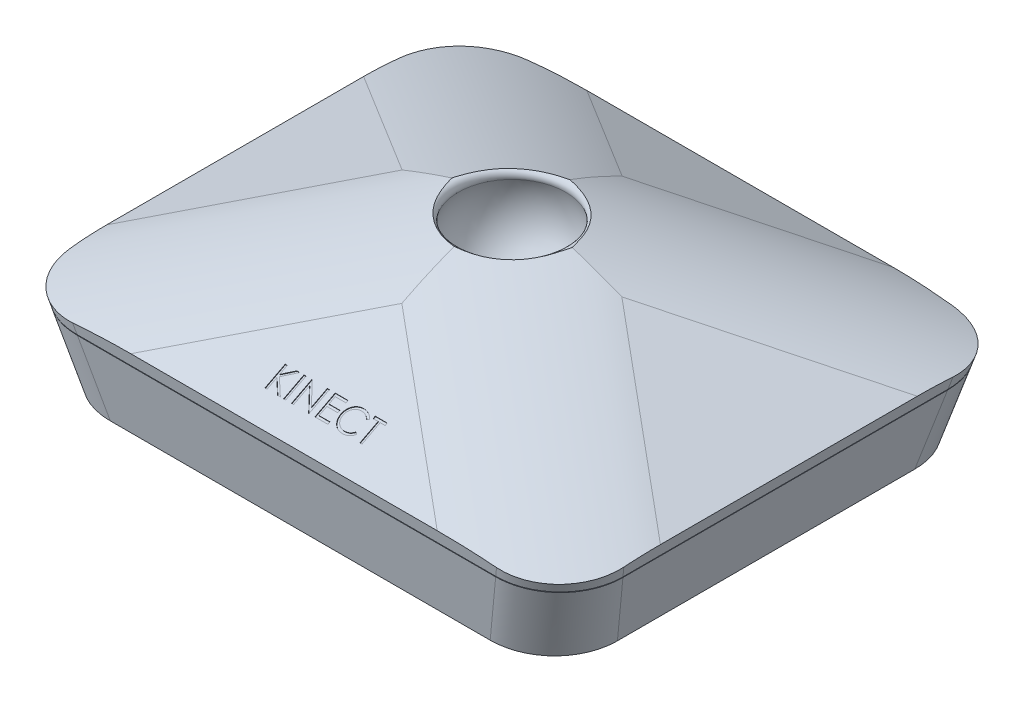
from build123d import *

# Parameters (mm, degrees)
SKETCH1_W               = 85
SKETCH1_H               = 70
BOSS_EXTRUDE1_DEPTH     = 26
CUT_EXTRUDE1_DEPTH      = 86.92002095
CUT_EXTRUDE2_DEPTH      = 86.92002095
CUT_EXTRUDE3_DEPTH      = 61.887190771
CUT_EXTRUDE3_DEPTH_BACK = 61.887190771
CUT_EXTRUDE4_DEPTH      = 61.887190771
CUT_EXTRUDE4_DEPTH_BACK = 61.887190771
SKETCH7_W               = 5
SKETCH7_H               = 5
CUT_EXTRUDE5_DEPTH      = 5
FILLET1_R               = 40
FILLET2_R               = 10
FILLET3_R               = 1
SKETCH9_W               = 0.314102565
SKETCH9_H               = 3.5
CUT_EXTRUDE6_DEPTH      = 0.1
BOSS_EXTRUDE2_DEPTH     = 0.5
CUT_EXTRUDE7_START      = 35
SKETCH11_W              = 95
SKETCH11_H              = 0.1
CUT_EXTRUDE7_DEPTH      = 10
CUT_EXTRUDE8_START      = 42.5
SKETCH12_W              = 50
SKETCH12_H              = 0.1
CUT_EXTRUDE8_DEPTH      = 1


with BuildPart() as part:
    # Sketch1 → Boss-Extrude1 (new body)
    with BuildSketch(Plane(origin=(0, 0, 0), x_dir=(1, 0, 0), z_dir=(0, 1, 0))):
        Rectangle(SKETCH1_W, SKETCH1_H)
    extrude(amount=BOSS_EXTRUDE1_DEPTH)

    # Sketch2 → Cut-Extrude1 (cut, through all)
    with BuildSketch(Plane.XY.offset(35)):
        Polygon((-39, 0), (-42.5, 0), (-42.5, 13), align=None)
        Polygon((39, 0), (42.5, 0), (42.5, 13), align=None)
    extrude(amount=-CUT_EXTRUDE1_DEPTH, mode=Mode.SUBTRACT)

    # Sketch3 → Cut-Extrude2 (cut, through all)
    with BuildSketch(Plane.XY.offset(35)):
        Polygon((-10, 26), (-42.5, 13), (-42.5, 26), align=None)
        Polygon((10, 26), (42.5, 13), (42.5, 26), align=None)
    extrude(amount=-CUT_EXTRUDE2_DEPTH, mode=Mode.SUBTRACT)

    # Sketch4 → Cut-Extrude3 (cut, two sides: drawn at the far end of the back side and taken through both)
    with BuildSketch(Plane(origin=(0, 0, 0), x_dir=(0, 0, -1), z_dir=(1, 0, 0)).offset(-CUT_EXTRUDE3_DEPTH_BACK)):
        Polygon((32.5, 0), (35, 13), (35, 0), align=None)
        Polygon((-32.5, 0), (-35, 13), (-35, 0), align=None)
    extrude(amount=CUT_EXTRUDE3_DEPTH + CUT_EXTRUDE3_DEPTH_BACK, mode=Mode.SUBTRACT)

    # Sketch5 → Cut-Extrude4 (cut, two sides: drawn at the far end of the back side and taken through both)
    with BuildSketch(Plane(origin=(0, 0, 0), x_dir=(0, 0, -1), z_dir=(1, 0, 0)).offset(-CUT_EXTRUDE4_DEPTH_BACK)):
        Polygon((10, 26), (35, 13), (35, 26), align=None)
        Polygon((-10, 26), (-35, 13), (-35, 26), align=None)
    extrude(amount=CUT_EXTRUDE4_DEPTH + CUT_EXTRUDE4_DEPTH_BACK, mode=Mode.SUBTRACT)

    # Sketch7 → Cut-Extrude5 (cut)
    with BuildSketch(Plane(origin=(0, 26, 0), x_dir=(1, 0, 0), z_dir=(0, 1, 0))):
        Rectangle(SKETCH7_W, SKETCH7_H)
    extrude(amount=-CUT_EXTRUDE5_DEPTH, mode=Mode.SUBTRACT)

    # Sketch8 → Cut-Revolve3 (revolve, cut)
    with BuildSketch(Plane(origin=(0, 21, 0), x_dir=(1, 0, 0), z_dir=(0, 1, 0))):
        with BuildLine():
            Line((-9, 0), (9, 0))
            ThreePointArc((9, 0), (0, 9), (-9, 0))
        make_face()
    revolve(axis=Axis((-17.101382006, 21, 0), (1, 0, 0)), mode=Mode.SUBTRACT)

    # Fillet1
    # the kernel refuses this fillet: 40 mm, written as the material it takes off along each edge
    with BuildSketch(Plane(origin=(-13.487478294, 35.394991318, 8.067290995), x_dir=(-0.6550810625309597, -0.34857902886565556, -0.6703442862801066), z_dir=(0.755558602302501, -0.30222344092100045, -0.5811989248480778)), Plane(origin=(-13.487478294, 35.394991318, -8.067290995), x_dir=(0.539629654489014, -0.2158518617956056, -0.8137615189694326), z_dir=(0.755558602302501, -0.3022234409210005, 0.581198924848078))) as fillet1_piece_1:
        with BuildLine():
            CenterArc((FILLET1_R * 0.310862429761, -FILLET1_R), FILLET1_R, 90, 34.537012927)
            Line((-FILLET1_R * 0.256076072353, -FILLET1_R * 0.176239880292), (0, 0))
            Line((0, 0), (FILLET1_R * 0.310862429761, 0))
        make_face()
    extrude(amount=105.18701838, mode=Mode.SUBTRACT)
    with BuildSketch(Plane(origin=(13.487478294, 35.394991318, 8.067290995), x_dir=(0.6550810625309597, -0.34857902886565556, -0.6703442862801066), z_dir=(-0.755558602302501, -0.30222344092100045, -0.5811989248480778)), Plane(origin=(13.487478294, 35.394991318, -8.067290995), x_dir=(-0.539629654489014, -0.2158518617956056, -0.8137615189694326), z_dir=(-0.755558602302501, -0.3022234409210005, 0.581198924848078))) as fillet1_piece_2:
        with BuildLine():
            CenterArc((FILLET1_R * 0.310862429761, FILLET1_R), FILLET1_R, 235.462987073, 34.537012927)
            Line((-FILLET1_R * 0.256076072353, FILLET1_R * 0.176239880292), (0, 0))
            Line((0, 0), (FILLET1_R * 0.310862429761, 0))
        make_face()
    extrude(amount=105.18701838, mode=Mode.SUBTRACT)

    # Fillet2
    fillet2_edges = [part.edges().sort_by_distance(p)[0] for p in [
        (-40.507776449, 5.600312524, -33.576983178),
        (40.507776449, 5.600312524, -33.576983178),
        (40.507776449, 5.600312524, 33.576983178),
        (-40.507776449, 5.600312524, 33.576983178),
    ]]
    fillet(fillet2_edges, radius=FILLET2_R)

    # Fillet3
    # the kernel refuses this fillet: 1 mm, written as the material it takes off along each edge
    with BuildSketch(Plane(origin=(0, 26, 0), x_dir=(0, 0, -1), z_dir=(-1, 0, 0))) as fillet3_piece_1:
        with BuildLine():
            CenterArc((9.16515139, 1), FILLET3_R, 156.421821522, 113.578178478)
            ThreePointArc((8.248636251, 1.4), (7.897060894, 0.683006921), (7.483314774, 0))
            Line((7.483314774, 0), (9.16515139, 0))
        make_face()
    revolve(axis=Axis((0, 26, 0), (0, -1, 0)), mode=Mode.SUBTRACT)

    # Sketch9 → Cut-Extrude6 (cut)
    with BuildSketch(Plane(origin=(0, 24.559193955, 12.770780856), x_dir=(1, 0, 0), z_dir=(0, 0.8872168012345952, 0.4613527366419895))):
        Polygon((-6.695257857, -17.294603055), (-6.381155293, -17.294603055), (-6.381155293, -18.627435587), (-4.922120838, -17.294603055), (-4.474104011, -17.294603055), (-6.193955774, -18.865115875), (-4.339488627, -20.794603055), (-4.758058338, -20.794603055), (-6.381155293, -19.105600651), (-6.381155293, -20.794603055), (-6.695257857, -20.794603055), align=None)
        with Locations((-3.666411704, -19.044603055)):
            Rectangle(SKETCH9_W, SKETCH9_H)
        Polygon((-2.611924524, -20.794603055), (-2.611924524, -17.294603055), (-2.546019075, -17.294603055), (-0.233719396, -20.049310587), (-0.233719396, -17.294603055), (0.080383168, -17.294603055), (0.080383168, -20.794603055), (0.008868745, -20.794603055), (-2.29782196, -18.046205619), (-2.29782196, -20.794603055), align=None)
        Polygon((0.977819066, -17.294603055), (2.95217804, -17.294603055), (2.95217804, -17.653577414), (1.29192163, -17.653577414), (1.29192163, -18.730500491), (2.95217804, -18.730500491), (2.95217804, -19.08947485), (1.29192163, -19.08947485), (1.29192163, -20.435628696), (2.95217804, -20.435628696), (2.95217804, -20.794603055), (0.977819066, -20.794603055), align=None)
        with BuildLine():
            Line((6.811152399, -17.936830619), (6.536312655, -18.147167157))
            add(Edge.make_bspline(
                [(6.536312655, -18.147167157), (6.516706767, -18.123801188), (6.47775932, -18.077384272), (6.415100118, -18.012204727), (6.349798475, -17.951139466), (6.281879354, -17.893897586), (6.210120234, -17.842480821), (6.136259435, -17.794209718), (6.05906139, -17.75094198), (5.952309656, -17.698478994), (5.812661807, -17.643732839), (5.636866968, -17.597829607), (5.45335587, -17.568608432), (5.32815827, -17.56544359), (5.26447772, -17.563833824)],
                knots=[0, 0, 0, 0, 0.757959112, 1.505699292, 2.245454638, 2.979532153, 3.711538275, 4.438200793, 5.171680507, 5.909471876, 7.393775596, 8.890124382, 10.418191784, 12, 12, 12, 12], degree=3))
            add(Edge.make_bspline(
                [(5.26447772, -17.563833824), (5.22939442, -17.564237787), (5.159553428, -17.565041963), (5.055904954, -17.575651088), (4.954191903, -17.590562298), (4.854480437, -17.612687621), (4.756897478, -17.64066024), (4.660805076, -17.674085654), (4.567594476, -17.715440494), (4.475976238, -17.761148754), (4.388197027, -17.812776199), (4.305141979, -17.86908955), (4.227114011, -17.929458647), (4.154051399, -17.994109753), (4.085879451, -18.062751714), (4.02309214, -18.136116055), (3.96590673, -18.213968229), (3.913189705, -18.295281636), (3.865976972, -18.379819428), (3.826447092, -18.467894498), (3.79144197, -18.557998601), (3.763742727, -18.651149762), (3.74181821, -18.746692528), (3.726690547, -18.844883316), (3.716202076, -18.945516996), (3.715401899, -19.013726308), (3.714998553, -19.048108664)],
                knots=[0, 0, 0, 0, 1.054917814, 2.100044995, 3.131103042, 4.146048494, 5.169673617, 6.183595914, 7.203665975, 8.234915748, 9.262203917, 10.264457458, 11.251630812, 12.227803204, 13.197192746, 14.159520551, 15.12972552, 16.100847026, 17.073214652, 18.039054194, 19.002613845, 19.979014051, 20.95965708, 21.949030935, 22.966165397, 24, 24, 24, 24], degree=3))
            add(Edge.make_bspline(
                [(3.714998553, -19.048108664), (3.716260372, -19.099839984), (3.718737786, -19.201407569), (3.74078612, -19.350178179), (3.774291212, -19.492698853), (3.824506788, -19.628078695), (3.886425839, -19.757987053), (3.964666451, -19.880225907), (4.055282988, -19.996642471), (4.159557407, -20.104485419), (4.273963223, -20.202999144), (4.396711135, -20.289749726), (4.527495423, -20.362064608), (4.664872053, -20.422240555), (4.809898167, -20.468497282), (4.962312969, -20.501061406), (5.121784965, -20.522303586), (5.230754364, -20.524337275), (5.286212495, -20.525372286)],
                knots=[0, 0, 0, 0, 1.029171465, 2.020641659, 2.987623507, 3.938342917, 4.889210282, 5.84687017, 6.821220943, 7.821438502, 8.827599549, 9.822697543, 10.807740252, 11.797342354, 12.80366471, 13.83203677, 14.896651826, 16, 16, 16, 16], degree=3))
            add(Edge.make_bspline(
                [(5.286212495, -20.525372286), (5.347315184, -20.523683506), (5.467579893, -20.520359583), (5.643947919, -20.492200334), (5.812783685, -20.446542416), (5.974096272, -20.382644494), (6.127430918, -20.299579206), (6.273027578, -20.198881329), (6.411009149, -20.079592996), (6.493980431, -19.988509868), (6.536312655, -19.942038952)],
                knots=[0, 0, 0, 0, 1.028121516, 2.023589091, 2.998037872, 3.967518031, 4.937445131, 5.927275754, 6.942489185, 8, 8, 8, 8], degree=3))
            Line((6.536312655, -19.942038952), (6.811152399, -20.150272125))
            add(Edge.make_bspline(
                [(6.811152399, -20.150272125), (6.789034289, -20.178810577), (6.744904014, -20.235750784), (6.673445997, -20.316022493), (6.5981687, -20.391526529), (6.51851299, -20.46165415), (6.435395198, -20.527808616), (6.347322886, -20.588110447), (6.255453853, -20.643401331), (6.160099374, -20.694028256), (6.061360761, -20.738945503), (5.959356326, -20.777399271), (5.854525751, -20.81052416), (5.746864242, -20.837776097), (5.636148486, -20.859047181), (5.522778012, -20.873266856), (5.406508136, -20.88300877), (5.328066715, -20.883896686), (5.288315861, -20.884346645)],
                knots=[0, 0, 0, 0, 0.986787822, 1.968848986, 2.935600012, 3.899624008, 4.868462664, 5.837806735, 6.815139263, 7.798259679, 8.787526145, 9.778297419, 10.776456485, 11.791383307, 12.812564526, 13.85620153, 14.913611965, 16, 16, 16, 16], degree=3))
            add(Edge.make_bspline(
                [(5.288315861, -20.884346645), (5.250672194, -20.884084652), (5.176236503, -20.883566594), (5.066337752, -20.875174427), (4.959348171, -20.86372469), (4.855573545, -20.846484559), (4.75444757, -20.826140219), (4.656886986, -20.798868962), (4.561931775, -20.768319796), (4.469963435, -20.732414809), (4.380903735, -20.691898626), (4.295039923, -20.646107067), (4.212411491, -20.595425203), (4.13220607, -20.540970192), (4.055608486, -20.48099289), (3.981954961, -20.416326256), (3.910832485, -20.347188245), (3.8668298, -20.297333392), (3.844706085, -20.272267318)],
                knots=[0, 0, 0, 0, 1.114604814, 2.203992996, 3.262667896, 4.300477797, 5.318619304, 6.316056647, 7.298880507, 8.271930387, 9.238335007, 10.195173496, 11.151986948, 12.108099108, 13.064862484, 14.031167946, 15.010108607, 16, 16, 16, 16], degree=3))
            add(Edge.make_bspline(
                [(3.844706085, -20.272267318), (3.809270441, -20.228726129), (3.738826965, -20.142169418), (3.648701281, -20.001883437), (3.571553726, -19.855415228), (3.509177805, -19.701995299), (3.460415072, -19.541967912), (3.426633877, -19.375252398), (3.404682272, -19.202004456), (3.402171984, -19.084167667), (3.400895989, -19.024270523)],
                knots=[0, 0, 0, 0, 0.994628077, 1.977248131, 2.950237994, 3.925870899, 4.908910175, 5.911660606, 6.938484602, 8, 8, 8, 8], degree=3))
            add(Edge.make_bspline(
                [(3.400895989, -19.024270523), (3.402451182, -18.961315069), (3.405510929, -18.837454145), (3.431506724, -18.655680191), (3.47332552, -18.481528793), (3.532722409, -18.315325048), (3.60802776, -18.156194768), (3.701054374, -18.005353563), (3.810721516, -17.861836763), (3.936169084, -17.727822012), (4.073736419, -17.605282659), (4.221055233, -17.497476456), (4.37783718, -17.40775894), (4.542355032, -17.332762777), (4.715840713, -17.275118314), (4.897924082, -17.234765127), (5.088262997, -17.209648011), (5.218125423, -17.206472803), (5.28410913, -17.204859465)],
                knots=[0, 0, 0, 0, 1.032925535, 2.032216505, 3.007276963, 3.968222605, 4.92396291, 5.891752235, 6.871517503, 7.883894988, 8.900124299, 9.891468569, 10.874487609, 11.85992873, 12.854644235, 13.869047385, 14.917252991, 16, 16, 16, 16], degree=3))
            add(Edge.make_bspline(
                [(5.28410913, -17.204859465), (5.324323602, -17.205341603), (5.403924099, -17.206295947), (5.521676751, -17.215602089), (5.636319078, -17.231115696), (5.74793006, -17.252231765), (5.857052677, -17.278439087), (5.962852918, -17.312579385), (6.065951604, -17.351615917), (6.165698513, -17.396574383), (6.261615063, -17.447041124), (6.353671381, -17.502456747), (6.44113624, -17.562752553), (6.524625088, -17.627415728), (6.602741299, -17.697814288), (6.677702778, -17.772011884), (6.746963856, -17.852145708), (6.789717051, -17.908550642), (6.811152399, -17.936830619)],
                knots=[0, 0, 0, 0, 1.096760587, 2.17092713, 3.219439832, 4.250915756, 5.268269357, 6.278326846, 7.281116186, 8.274029601, 9.260640565, 10.235837813, 11.203064059, 12.156899882, 13.114053108, 14.069676657, 15.032185724, 16, 16, 16, 16], degree=3))
        make_face()
        Polygon((7.125254963, -17.653577414), (7.125254963, -17.294603055), (8.964998553, -17.294603055), (8.964998553, -17.653577414), (8.20217804, -17.653577414), (8.20217804, -20.794603055), (7.888075476, -20.794603055), (7.888075476, -17.653577414), align=None)
    extrude(amount=-CUT_EXTRUDE6_DEPTH, mode=Mode.SUBTRACT)

    # Sketch10 → Boss-Extrude2 (add)
    with BuildSketch(Plane.XZ):
        with BuildLine():
            Line((-29.152349123, 31.803152106), (29.152349123, 31.803152106))
            ThreePointArc((29.152349123, 31.803152106), (35.364432178, 29.031276619), (38.130749501, 22.816716453))
            Line((38.130749501, 22.816716453), (38.130749501, -22.816716453))
            ThreePointArc((38.130749501, -22.816716453), (35.364432178, -29.031276619), (29.152349123, -31.803152106))
            Line((29.152349123, -31.803152106), (-29.152349123, -31.803152106))
            ThreePointArc((-29.152349123, -31.803152106), (-35.364432178, -29.031276619), (-38.130749501, -22.816716453))
            Line((-38.130749501, -22.816716453), (-38.130749501, 22.816716453))
            ThreePointArc((-38.130749501, 22.816716453), (-35.364432178, 29.031276619), (-29.152349123, 31.803152106))
        make_face()
    extrude(amount=BOSS_EXTRUDE2_DEPTH)

    # Sketch11 → Cut-Extrude7 (cut)
    with BuildSketch(Plane.XY.offset(CUT_EXTRUDE7_START)):
        with Locations((0, 11)):
            Rectangle(SKETCH11_W, SKETCH11_H)
    cut_extrude7 = extrude(amount=-CUT_EXTRUDE7_DEPTH, mode=Mode.SUBTRACT)

    # Mirror1: Cut-Extrude7 across plane
    add(cut_extrude7.mirror(Plane.XY), mode=Mode.SUBTRACT)

    # Sketch12 → Cut-Extrude8 (cut)
    with BuildSketch(Plane(origin=(0, 0, 0), x_dir=(0, 0, -1), z_dir=(1, 0, 0)).offset(CUT_EXTRUDE8_START)):
        with Locations((0, 11)):
            Rectangle(SKETCH12_W, SKETCH12_H)
    cut_extrude8 = extrude(amount=-CUT_EXTRUDE8_DEPTH, mode=Mode.SUBTRACT)

    # Mirror2: Cut-Extrude8 across plane
    add(cut_extrude8.mirror(Plane(origin=(0, 0, 0), x_dir=(0, 0, 1), z_dir=(1, 0, 0))), mode=Mode.SUBTRACT)


solid = part.part
